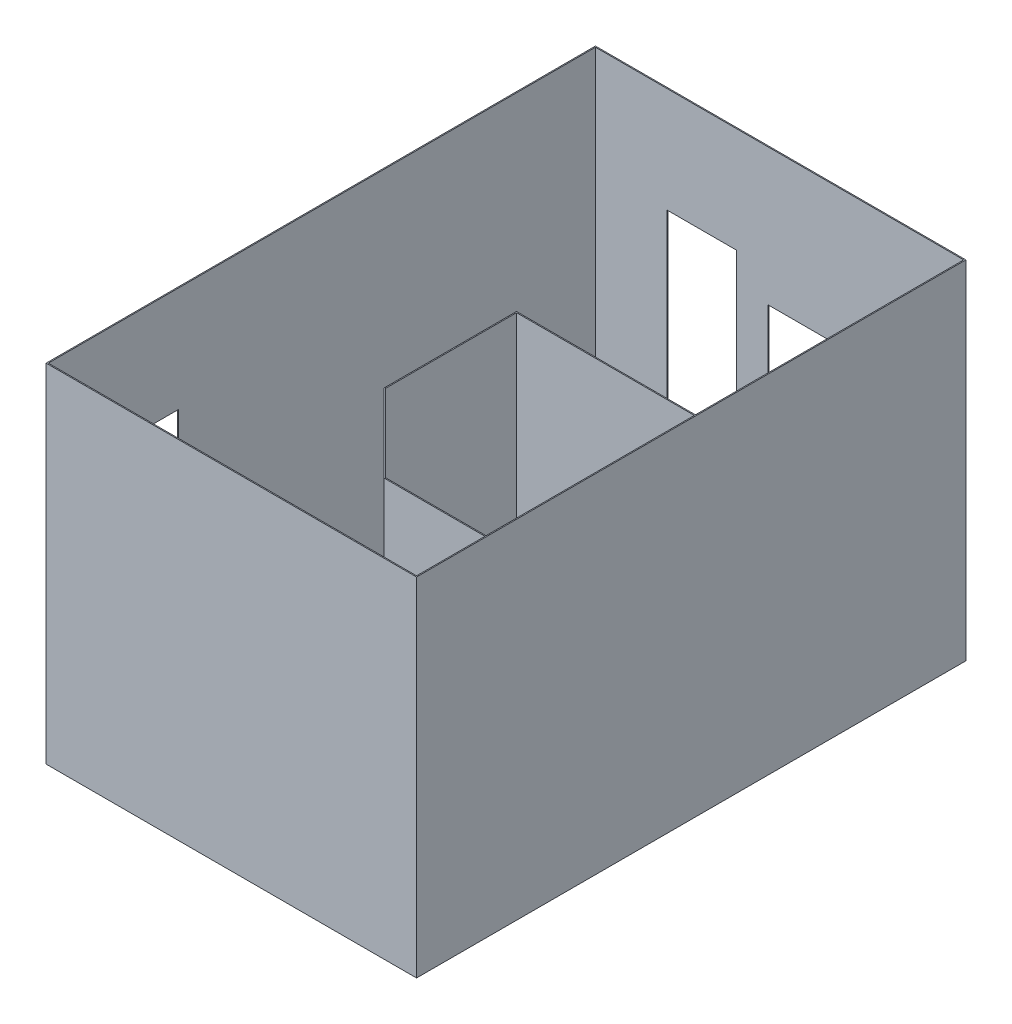
from build123d import *

# Parameters (mm, degrees)
EXTRUDE_2_DEPTH     = 330
SKETCH_1_W          = 352
SKETCH_1_H          = 522
SKETCH_1_W_2        = 350
SKETCH_1_H_2        = 520
EXTRUDE_2_2_DEPTH   = 330
SKETCH_2_W          = 66
SKETCH_2_H          = 220
SKETCH_2_W_2        = 154
SKETCH_2_H_2        = 100
CUT_EXTRUDE_1_DEPTH = 10
SKETCH_4_W          = 65
SKETCH_4_H          = 220
CUT_EXTRUDE_2_DEPTH = 10
SKETCH_5_W          = 82
SKETCH_5_H          = 220
CUT_EXTRUDE_3_DEPTH = 10


with BuildPart() as part:
    # Эскиз1 → Вытянуть-Тонкостенный2 (new body)
    with BuildSketch(Plane(origin=(0, 0, 0), x_dir=(1, 0, 0), z_dir=(0, 1, 0))):
        Polygon((0, 65), (-95.753787975, 65), (-170, 139.246212025), (-170, 265), (0, 265), (0, 264), (-169, 264), (-169, 139.660425587), (-95.339574413, 66), (0, 66), align=None)
    extrude(amount=EXTRUDE_2_DEPTH)

    # Эскиз4 → Вырез-Вытянуть2 (cut)
    with BuildSketch(Plane(origin=(-15.376893988, 0, 15.376893988), x_dir=(0.7071067811865462, 0, 0.7071067811865488), z_dir=(-0.7071067811865488, 0, 0.7071067811865462))):
        with Locations((-166.170093579, 110)):
            Rectangle(SKETCH_4_W, SKETCH_4_H)
    extrude(amount=-CUT_EXTRUDE_2_DEPTH, mode=Mode.SUBTRACT)


with BuildPart() as body_2:
    # Эскиз1 → Extrude 2 2 (new body)
    with BuildSketch(Plane(origin=(0, 0, 0), x_dir=(1, 0, 0), z_dir=(0, 1, 0))):
        with Locations((-175, 260)):
            Rectangle(SKETCH_1_W, SKETCH_1_H)
        with Locations((-175, 260)):
            Rectangle(SKETCH_1_W_2, SKETCH_1_H_2, mode=Mode.SUBTRACT)
    extrude(amount=EXTRUDE_2_2_DEPTH)

    # Эскиз2 → Вырез-Вытянуть1 (cut)
    with BuildSketch(Plane(origin=(0, 0, -521), x_dir=(-1, 0, 0), z_dir=(0, 0, -1))):
        with Locations((249, 120)):
            Rectangle(SKETCH_2_W, SKETCH_2_H)
        with Locations((109, 150)):
            Rectangle(SKETCH_2_W_2, SKETCH_2_H_2)
    extrude(amount=-CUT_EXTRUDE_1_DEPTH, mode=Mode.SUBTRACT)

    # Эскиз5 → Вырез-Вытянуть3 (cut)
    with BuildSketch(Plane.ZY.offset(351)):
        with Locations((-83, 120)):
            Rectangle(SKETCH_5_W, SKETCH_5_H)
    extrude(amount=-CUT_EXTRUDE_3_DEPTH, mode=Mode.SUBTRACT)


solid = Compound([part.part, body_2.part])
